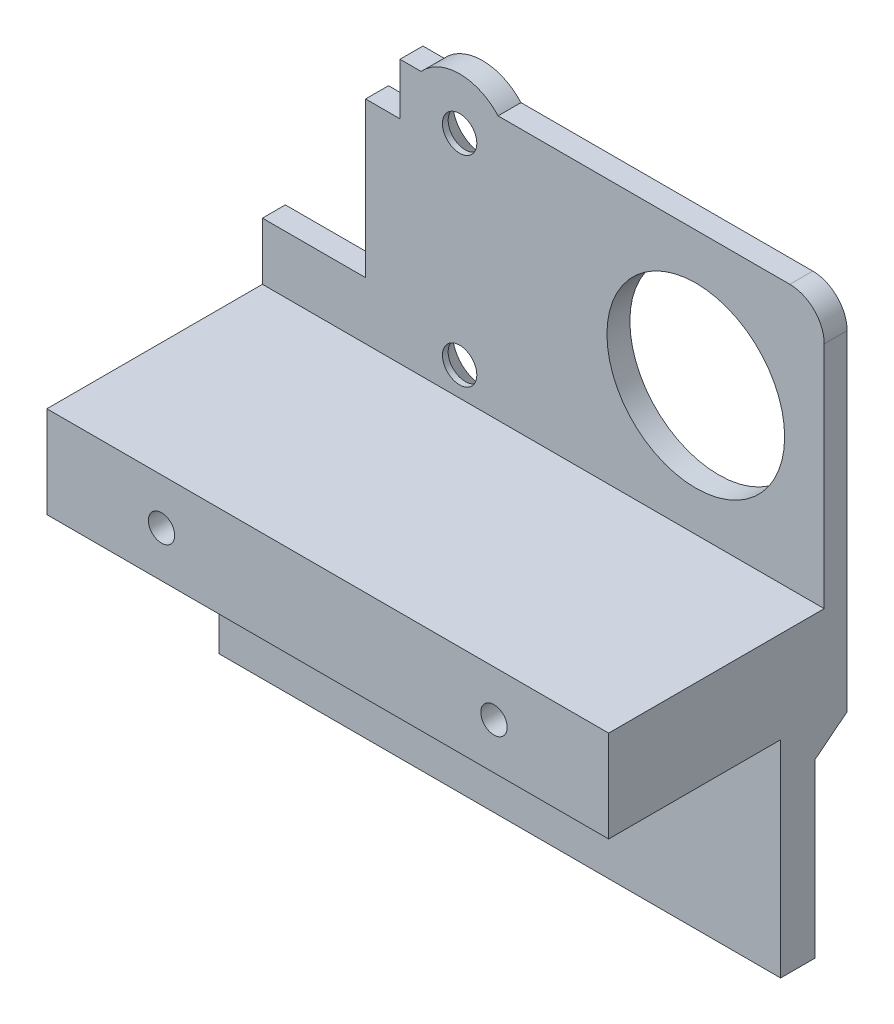
from build123d import *

# Parameters (mm, degrees)
SKETCH_5_R              = 1.75
EXTRUDE_15981_DEPTH     = 3
EXTRUDE_2_DEPTH         = 15
EXTRUDE_2_DEPTH_BACK    = 5.8
SKETCH_6_W              = 49
SKETCH_6_H              = 8
EXTRUDE_START           = -5.8
SKETCH_7_R              = 1.5
SKETCH_7_R_2            = 7.75
EXTRUDE_3_DEPTH         = 2
CUT_EXTRUDE_START       = 15
SKETCH_9_R              = 1.15
CUT_EXTRUDE_16680_DEPTH = 10
CHAMFER_16885_SIZE      = 3
CHAMFER_16885_SIZE_2    = 3.8
FILLET_16929_R          = 3


with BuildPart() as part:
    # Sketch 5 → Extrude 15981 (new body)
    with BuildSketch(Plane.XY):
        Polygon((18.5, -24.5), (18.5, -6.5), (-30.5, -6.5), (-30.5, -24.5), (-18.5, -24.5), align=None)
        with Locations((-20.5, -14)):
            Circle(SKETCH_5_R, mode=Mode.SUBTRACT)
        with Locations((8.5, -14)):
            Circle(SKETCH_5_R, mode=Mode.SUBTRACT)
    extrude(amount=-EXTRUDE_15981_DEPTH)

    # Эскиз внешнего крепления двигателя колеса<6> → Extrude 2 (add, two sides: drawn at the far end of the back side and taken through both)
    with BuildSketch(Plane.XY.offset(-EXTRUDE_2_DEPTH_BACK)):
        with Locations((-6, -2.5)):
            Rectangle(SKETCH_6_W, SKETCH_6_H)
    extrude(amount=EXTRUDE_2_DEPTH + EXTRUDE_2_DEPTH_BACK)

    # Sketch 7 → Extrude 3 (add)
    with BuildSketch(Plane.XY.offset(EXTRUDE_START)):
        with BuildLine():
            ThreePointArc((-9.945898034, 24.5), (-13.3, 26), (-16.654101966, 24.5))
            Line((-16.654101966, 24.5), (-18.5, 24.5))
            Line((-18.5, 24.5), (-18.5, 20))
            Line((-18.5, 20), (-21.5, 20))
            Line((-21.5, 20), (-21.5, 6.5))
            Line((-21.5, 6.5), (-30.5, 6.5))
            Line((-30.5, 6.5), (-30.5, 1.5))
            Line((-30.5, 1.5), (18.5, 1.5))
            Line((18.5, 1.5), (18.5, 24.5))
            Line((18.5, 24.5), (-9.945898034, 24.5))
        make_face()
        with Locations((-13.3, 4)):
            Circle(SKETCH_7_R, mode=Mode.SUBTRACT)
        with Locations((-13.3, 21.5)):
            Circle(SKETCH_7_R, mode=Mode.SUBTRACT)
        with Locations((7.3, 12.75)):
            Circle(SKETCH_7_R_2, mode=Mode.SUBTRACT)
    extrude(amount=EXTRUDE_3_DEPTH)

    # Sketch 9 → Cut-Extrude 16680 (cut)
    with BuildSketch(Plane.XY.offset(CUT_EXTRUDE_START)):
        with Locations((8.5, -2.5)):
            Circle(SKETCH_9_R)
        with Locations((-20.5, -2.5)):
            Circle(SKETCH_9_R)
    extrude(amount=-CUT_EXTRUDE_16680_DEPTH, mode=Mode.SUBTRACT)

    # Chamfer 16786: read off the stored shape, not the designer's step
    # Chamfer 16786: loft between two sections, ruled curve by curve
    chamfer_16786_from = [
        Edge.make_three_point_arc((-11.8, 4, -4.3), (-13.3, 2.5, -4.3), (-14.8, 4, -4.3)),
        Edge.make_three_point_arc((-14.8, 4, -4.3), (-13.3, 5.5, -4.3), (-11.8, 4, -4.3)),
    ]
    chamfer_16786_to = [
        Edge.make_three_point_arc((-10.7, 4, -5.8), (-13.3, 1.4, -5.8), (-15.9, 4, -5.8)),
        Edge.make_three_point_arc((-15.9, 4, -5.8), (-13.3, 6.6, -5.8), (-10.7, 4, -5.8)),
    ]
    chamfer_16786 = Solid(Shell([*[Face.make_surface_from_curves(chamfer_16786_from[k], chamfer_16786_to[k]) for k in range(2)], Face(Wire(chamfer_16786_from)), Face(Wire(chamfer_16786_to))]))
    add(chamfer_16786, mode=Mode.SUBTRACT)

    # Chamfer 16786 2: loft between two sections, ruled curve by curve
    chamfer_16786_2_from = [
        Edge.make_three_point_arc((-11.8, 21.5, -4.3), (-13.3, 20, -4.3), (-14.8, 21.5, -4.3)),
        Edge.make_three_point_arc((-14.8, 21.5, -4.3), (-13.3, 23, -4.3), (-11.8, 21.5, -4.3)),
    ]
    chamfer_16786_2_to = [
        Edge.make_three_point_arc((-10.7, 21.5, -5.8), (-13.3, 18.9, -5.8), (-15.9, 21.5, -5.8)),
        Edge.make_three_point_arc((-15.9, 21.5, -5.8), (-13.3, 24.1, -5.8), (-10.7, 21.5, -5.8)),
    ]
    chamfer_16786_2 = Solid(Shell([*[Face.make_surface_from_curves(chamfer_16786_2_from[k], chamfer_16786_2_to[k]) for k in range(2)], Face(Wire(chamfer_16786_2_from)), Face(Wire(chamfer_16786_2_to))]))
    add(chamfer_16786_2, mode=Mode.SUBTRACT)

    # Chamfer 16885
    # the kernel refuses this chamfer: 3.8, 3 mm, written as the material it adds along each edge
    with BuildSketch(Plane(origin=(18.5, -6.5, -3), x_dir=(0, -1, 0), z_dir=(-1, 0, 0))) as chamfer_16885_piece_1_section:
        Polygon((CHAMFER_16885_SIZE, 0), (0, -CHAMFER_16885_SIZE_2), (0, 0), align=None)
    chamfer_16885_piece_1 = extrude(amount=49, mode=Mode.PRIVATE)
    chamfer_16885_piece_1 = split(chamfer_16885_piece_1, bisect_by=Plane(origin=(18.5, -6.5, -5.8), z_dir=(0, 0, 1)), keep=Keep.TOP, mode=Mode.PRIVATE)
    add(chamfer_16885_piece_1)

    # Fillet 16929
    fillet_16929_edges = [part.edges().sort_by_distance(p)[0] for p in [
        (18.5, 24.5, -4.8),
    ]]
    fillet(fillet_16929_edges, radius=FILLET_16929_R)


solid = part.part
